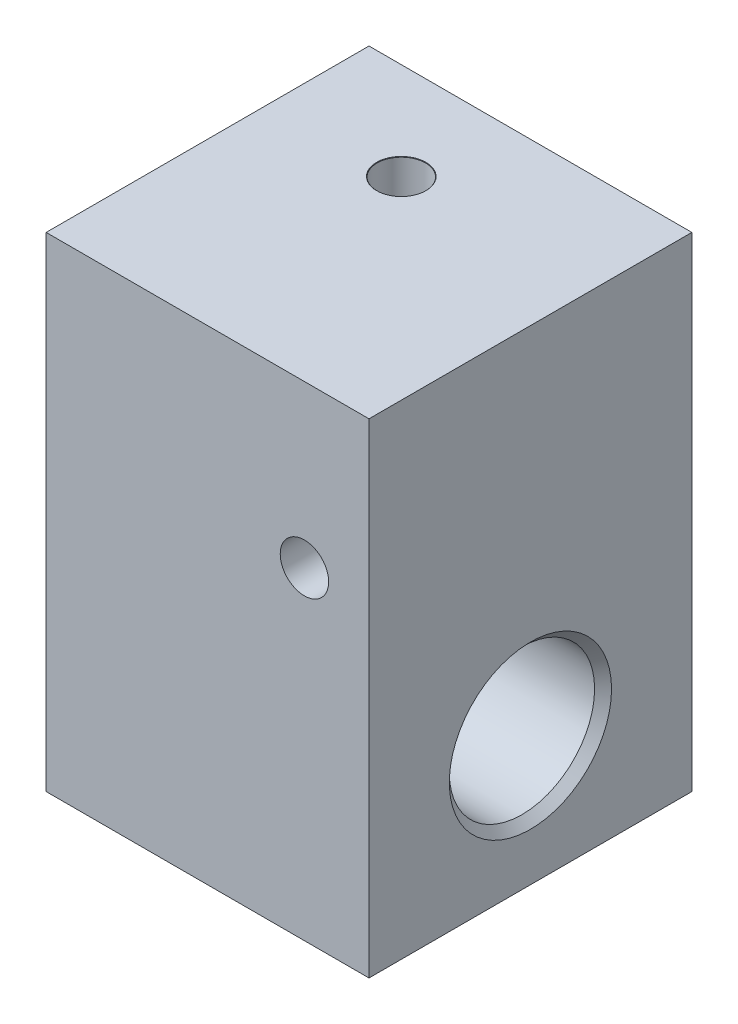
from build123d import *

# Parameters (mm, degrees)
SKETCH1_W                        = 20
SKETCH1_H                        = 20
BOSS_EXTRUDE1_DEPTH              = 30
F_3_0MM_DOWEL_HOLE1_D            = 3
F_3_0MM_DOWEL_HOLE1_DEPTH        = 20
F_3_0MM_DOWEL_HOLE1_CSINK_D      = 3.05
F_3_0MM_DOWEL_HOLE1_CSINK_ANGLE  = 90
F_3_0MM_DOWEL_HOLE1_TIP          = 0.901290929
F_3_0MM_DOWEL_HOLE2_D            = 3
F_3_0MM_DOWEL_HOLE2_DEPTH        = 12
F_3_0MM_DOWEL_HOLE2_CSINK_D      = 3.05
F_3_0MM_DOWEL_HOLE2_CSINK_ANGLE  = 90
F_3_0MM_DOWEL_HOLE2_TIP          = 0.901290929
F_3_0MM_DOWEL_HOLE3_D            = 3
F_3_0MM_DOWEL_HOLE3_DEPTH        = 20
F_3_0MM_DOWEL_HOLE3_CSINK_D      = 3.05
F_3_0MM_DOWEL_HOLE3_CSINK_ANGLE  = 90
F_3_0MM_DOWEL_HOLE3_TIP          = 0.901290929
F_10_0MM_DOWEL_HOLE1_D           = 9
F_10_0MM_DOWEL_HOLE1_DEPTH       = 17
F_10_0MM_DOWEL_HOLE1_CSINK_D     = 10.05
F_10_0MM_DOWEL_HOLE1_CSINK_ANGLE = 90
F_10_0MM_DOWEL_HOLE1_TIP         = 2.703872786


with BuildPart() as part:
    # Sketch1 → Boss-Extrude1 (new body)
    with BuildSketch(Plane(origin=(0, 0, 0), x_dir=(1, 0, 0), z_dir=(0, 1, 0))):
        with Locations((10, -8.099538279)):
            Rectangle(SKETCH1_W, SKETCH1_H)
    extrude(amount=BOSS_EXTRUDE1_DEPTH)

    # Ø3.0mm Dowel Hole1
    with Locations(Plane(origin=(0, 0, -1.900461721), x_dir=(-1, 0, 0), z_dir=(0, 0, -1))):
        with Locations((-16, 20)):
            CounterSinkHole(F_3_0MM_DOWEL_HOLE1_D / 2, F_3_0MM_DOWEL_HOLE1_CSINK_D / 2, depth=F_3_0MM_DOWEL_HOLE1_DEPTH, counter_sink_angle=F_3_0MM_DOWEL_HOLE1_CSINK_ANGLE)
            with Locations((0, 0, -(F_3_0MM_DOWEL_HOLE1_DEPTH + F_3_0MM_DOWEL_HOLE1_TIP / 2))):  # 118° drill point
                Cone(0, F_3_0MM_DOWEL_HOLE1_D / 2, F_3_0MM_DOWEL_HOLE1_TIP, mode=Mode.SUBTRACT)

    # Ø3.0mm Dowel Hole2
    with Locations(Plane.ZY):
        with Locations((8.099538279, 25)):
            CounterSinkHole(F_3_0MM_DOWEL_HOLE2_D / 2, F_3_0MM_DOWEL_HOLE2_CSINK_D / 2, depth=F_3_0MM_DOWEL_HOLE2_DEPTH, counter_sink_angle=F_3_0MM_DOWEL_HOLE2_CSINK_ANGLE)
            with Locations((0, 0, -(F_3_0MM_DOWEL_HOLE2_DEPTH + F_3_0MM_DOWEL_HOLE2_TIP / 2))):  # 118° drill point
                Cone(0, F_3_0MM_DOWEL_HOLE2_D / 2, F_3_0MM_DOWEL_HOLE2_TIP, mode=Mode.SUBTRACT)

    # Ø3.0mm Dowel Hole3
    with Locations(Plane(origin=(0, 30, 0), x_dir=(1, 0, 0), z_dir=(0, 1, 0))):
        with Locations((8, -4.099538279)):
            CounterSinkHole(F_3_0MM_DOWEL_HOLE3_D / 2, F_3_0MM_DOWEL_HOLE3_CSINK_D / 2, depth=F_3_0MM_DOWEL_HOLE3_DEPTH, counter_sink_angle=F_3_0MM_DOWEL_HOLE3_CSINK_ANGLE)
            with Locations((0, 0, -(F_3_0MM_DOWEL_HOLE3_DEPTH + F_3_0MM_DOWEL_HOLE3_TIP / 2))):  # 118° drill point
                Cone(0, F_3_0MM_DOWEL_HOLE3_D / 2, F_3_0MM_DOWEL_HOLE3_TIP, mode=Mode.SUBTRACT)

    # Ø10.0mm Dowel Hole1
    with Locations(Plane(origin=(20, 0, 0), x_dir=(0, 0, -1), z_dir=(1, 0, 0))):
        with Locations((-8.099538279, 8)):
            CounterSinkHole(F_10_0MM_DOWEL_HOLE1_D / 2, F_10_0MM_DOWEL_HOLE1_CSINK_D / 2, depth=F_10_0MM_DOWEL_HOLE1_DEPTH, counter_sink_angle=F_10_0MM_DOWEL_HOLE1_CSINK_ANGLE)
            with Locations((0, 0, -(F_10_0MM_DOWEL_HOLE1_DEPTH + F_10_0MM_DOWEL_HOLE1_TIP / 2))):  # 118° drill point
                Cone(0, F_10_0MM_DOWEL_HOLE1_D / 2, F_10_0MM_DOWEL_HOLE1_TIP, mode=Mode.SUBTRACT)


solid = part.part
